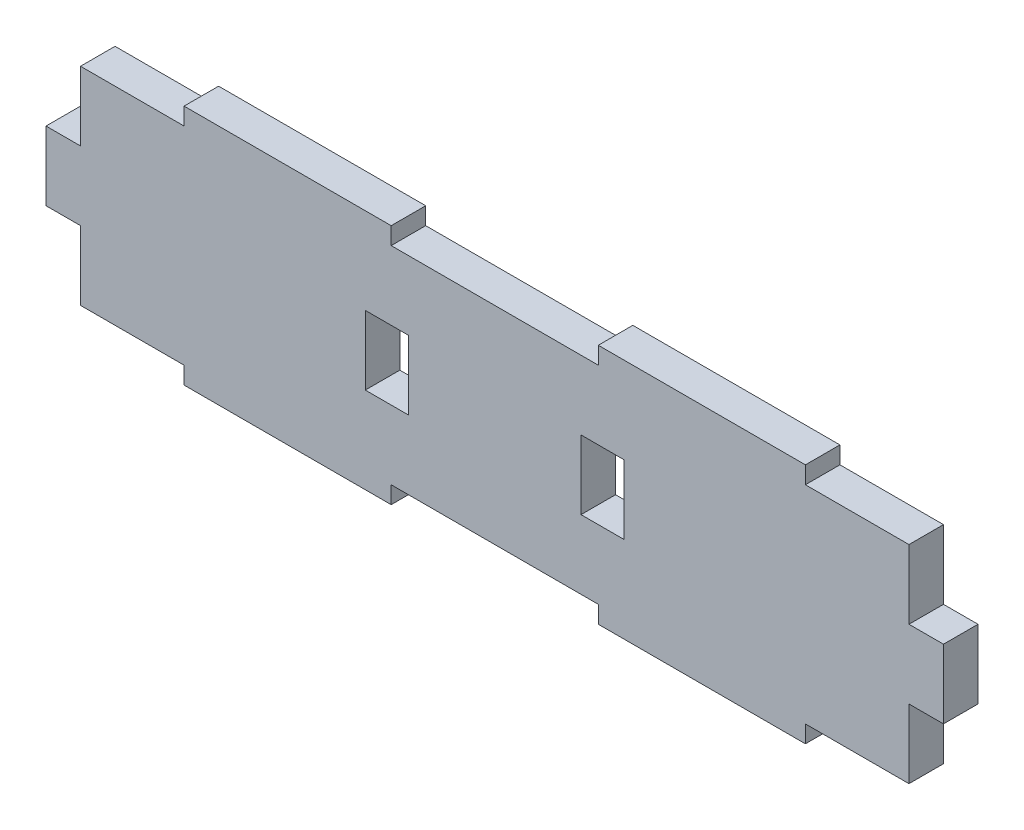
from build123d import *

# Parameters (mm, degrees)
SKETCH1_W           = 330.2
SKETCH1_H           = 76.2
BOSS_EXTRUDE1_DEPTH = 12.7
SKETCH2_W           = 76.2
SKETCH2_H           = 6.35
BOSS_EXTRUDE2_DEPTH = 12.7
SKETCH3_W           = 12.7
SKETCH3_H           = 25.4
SKETCH3_W_2         = 15.875
CUT_EXTRUDE1_DEPTH  = 172.45


with BuildPart() as part:
    # Sketch1 → Boss-Extrude1 (new body)
    with BuildSketch(Plane.XY):
        Rectangle(SKETCH1_W, SKETCH1_H)
    extrude(amount=BOSS_EXTRUDE1_DEPTH)

    # Sketch2 → Boss-Extrude2 (add)
    with BuildSketch(Plane.XY.offset(12.7)):
        with Locations((-76.2, -41.275)):
            Rectangle(SKETCH2_W, SKETCH2_H)
        with Locations((76.2, -41.275)):
            Rectangle(SKETCH2_W, SKETCH2_H)
        with Locations((76.2, 41.275)):
            Rectangle(SKETCH2_W, SKETCH2_H)
        with Locations((-76.2, 41.275)):
            Rectangle(SKETCH2_W, SKETCH2_H)
    extrude(amount=-BOSS_EXTRUDE2_DEPTH)

    # Sketch3 → Cut-Extrude1 (cut, through all)
    with BuildSketch(Plane.XY.offset(12.7)):
        with Locations((-158.75, -25.4)):
            Rectangle(SKETCH3_W, SKETCH3_H)
        with Locations((-158.75, 25.4)):
            Rectangle(SKETCH3_W, SKETCH3_H)
        with Locations((158.75, 25.4)):
            Rectangle(SKETCH3_W, SKETCH3_H)
        with Locations((158.75, -25.4)):
            Rectangle(SKETCH3_W, SKETCH3_H)
        with Locations((39.6875, 0)):
            Rectangle(SKETCH3_W_2, SKETCH3_H)
        with Locations((-39.6875, 0)):
            Rectangle(SKETCH3_W_2, SKETCH3_H)
    extrude(amount=-CUT_EXTRUDE1_DEPTH, mode=Mode.SUBTRACT)


solid = part.part
